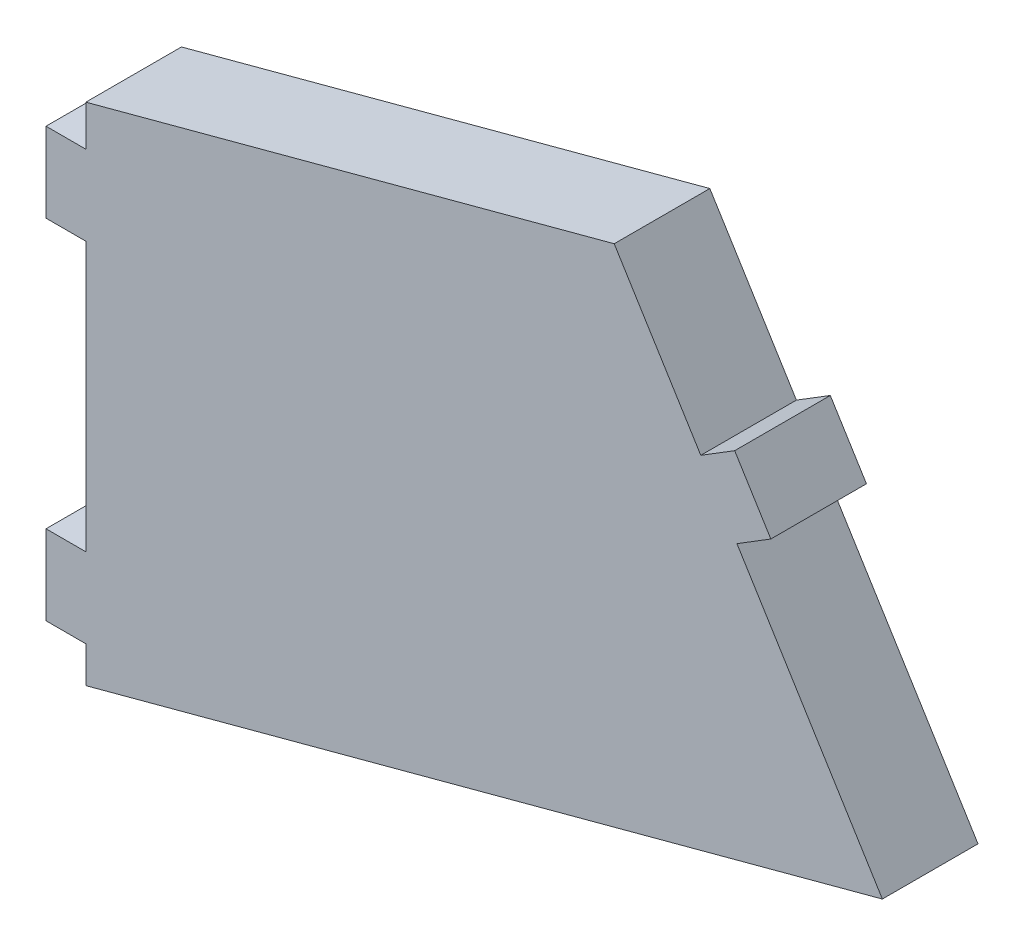
from build123d import *

# Parameters (mm, degrees)
BOSS_EXTRUDE2_DEPTH = 6


with BuildPart() as part:
    # Sketch2 → Boss-Extrude2 (new body)
    with BuildSketch(Plane.XY):
        Polygon((1.242157744, 46.463405348), (1.242157744, 29.588316608), (-1.257842256, 29.588316608), (-1.257842256, 24.588316608), (1.242157744, 24.588316608), (1.242157744, 22.314883628), (51.219413317, 35.706248899), (42.094160615, 50.45598495), (44.22018054, 51.771294525), (41.952249218, 55.437098583), (39.826229293, 54.121789007), (34.393557167, 62.902968281), (1.242157744, 54.020077578), (1.242157744, 51.463405348), (-1.257842256, 51.463405348), (-1.257842256, 46.463405348), align=None)
    extrude(amount=-BOSS_EXTRUDE2_DEPTH)


solid = part.part
